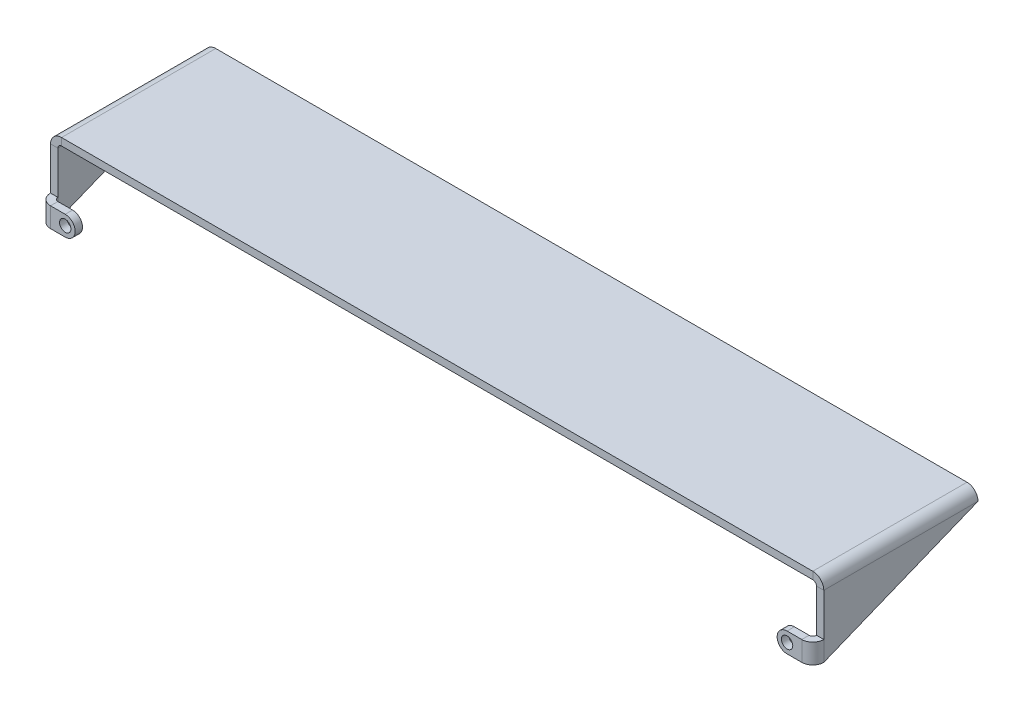
from build123d import *

# Parameters (mm, degrees)
SKETCH1_W                          = 210.6
SKETCH1_H                          = 45
BASE_FLANGE1_DEPTH                 = 2
SM_EDGE_FLANGE_1_STRIP_W           = 10
SM_EDGE_FLANGE_1_STRIP_H           = 2
SM_EDGE_FLANGE_1_STRIP_CUT_DEPTH   = 45
SM_EDGE_FLANGE_1_STRIP_2_W         = 10
SM_EDGE_FLANGE_1_STRIP_2_H         = 2
SM_EDGE_FLANGE_1_STRIP_CUT_2_DEPTH = 45
SM_EDGE_FLANGE_1_DEPTH             = 45
SM_EDGE_FLANGE_1_BEND_DEPTH        = 45
SM_START                           = -20
SM_EDGE_FLANGE_2_DEPTH             = 20
SM_START_2                         = -3
SM_EDGE_FLANGE_2_2_DEPTH           = 3
SM_EDGE_FLANGE_2_3_DEPTH           = 17
SKETCH18_R                         = 1.55
CUT_EXTRUDE4_DEPTH                 = 10
CUT_EXTRUDE5_DEPTH                 = 213.740710726
CUT_EXTRUDE5_DEPTH_BACK            = 213.740710726
SKETCH22_W                         = 3
SKETCH22_H                         = 2
SKETCH22_H_2                       = 11.6


# Read off the part's stored shape, not the designer's step: Ребро-кромка2
# Sheet-metal steps are written as plain solids
with BuildPart() as part:
    # Sketch1 → Base-Flange1 (new body)
    with BuildSketch(Plane(origin=(0, 0, 0), x_dir=(1, 0, 0), z_dir=(0, 1, 0))):
        Rectangle(SKETCH1_W, SKETCH1_H)
    extrude(amount=-BASE_FLANGE1_DEPTH)

    # Ребро-кромка1 strip (across the edge) → Ребро-кромка1 strip cut (cut)
    with BuildSketch(Plane(origin=(-105.3, -2, 22.5), x_dir=(1, 0, 0), z_dir=(0, 0, -1))):
        with Locations((-2, -1)):
            Rectangle(SM_EDGE_FLANGE_1_STRIP_W, SM_EDGE_FLANGE_1_STRIP_H)
    extrude(amount=SM_EDGE_FLANGE_1_STRIP_CUT_DEPTH, mode=Mode.SUBTRACT)

    # Ребро-кромка1 strip 2 (across the edge) → Ребро-кромка1 strip cut 2 (cut)
    with BuildSketch(Plane(origin=(105.3, -2, -22.5), x_dir=(-1, 0, 0), z_dir=(0, 0, 1))):
        with Locations((-2, -1)):
            Rectangle(SM_EDGE_FLANGE_1_STRIP_2_W, SM_EDGE_FLANGE_1_STRIP_2_H)
    extrude(amount=SM_EDGE_FLANGE_1_STRIP_CUT_2_DEPTH, mode=Mode.SUBTRACT)

    # Ребро-кромка1 section (across the edge) → Ребро-кромка1 (add)
    with BuildSketch(Plane(origin=(-105.3, -2, 22.5), x_dir=(1, 0, 0), z_dir=(0, 0, -1))):
        with BuildLine():
            Line((0, 1), (0, 18))
            Line((0, 18), (2, 18))
            Line((2, 18), (2, 1))
            ThreePointArc((2, 1), (2.292893219, 0.292893219), (3, 0))
            Line((3, 0), (3, -2))
            ThreePointArc((3, -2), (0.878679656, -1.121320344), (0, 1))
        make_face()
    extrude(amount=SM_EDGE_FLANGE_1_DEPTH)

    # Ребро-кромка1 section 2 (across the edge) → Ребро-кромка1 bend (add)
    with BuildSketch(Plane(origin=(105.3, -2, -22.5), x_dir=(-1, 0, 0), z_dir=(0, 0, 1))):
        with BuildLine():
            Line((0, 1), (0, 18))
            Line((0, 18), (2, 18))
            Line((2, 18), (2, 1))
            ThreePointArc((2, 1), (2.292893219, 0.292893219), (3, 0))
            Line((3, 0), (3, -2))
            ThreePointArc((3, -2), (0.878679656, -1.121320344), (0, 1))
        make_face()
    extrude(amount=SM_EDGE_FLANGE_1_BEND_DEPTH)

    # Ребро-кромка2 outline → Ребро-кромка2 (cut)
    with BuildSketch(Plane(origin=(0, 0, 0), x_dir=(1, 0, 0), z_dir=(0, 1, 0)).offset(SM_START)):
        with BuildLine():
            Line((-102.3, -20.5), (-102.3, -19.5))
            Line((-102.3, -19.5), (-103.3, -19.5))
            ThreePointArc((-103.3, -19.5), (-103.007106781, -20.207106781), (-102.3, -20.5))
        make_face()
        with BuildLine():
            ThreePointArc((-102.3, -22.5), (-104.421320344, -21.621320344), (-105.3, -19.5))
            Line((-105.3, -19.5), (-105.3, -22.5))
            Line((-105.3, -22.5), (-102.3, -22.5))
        make_face()
        with BuildLine():
            Line((102.3, -22.5), (105.3, -22.5))
            Line((105.3, -22.5), (105.3, -19.5))
            ThreePointArc((105.3, -19.5), (104.421320344, -21.621320344), (102.3, -22.5))
        make_face()
        with BuildLine():
            Line((102.3, -19.5), (102.3, -20.5))
            ThreePointArc((102.3, -20.5), (103.007106781, -20.207106781), (103.3, -19.5))
            Line((103.3, -19.5), (102.3, -19.5))
        make_face()
    extrude(amount=SM_EDGE_FLANGE_2_DEPTH, mode=Mode.SUBTRACT)

    # Sm Edge Flange 2 2 outline → Sm Edge Flange 2 2 (cut)
    with BuildSketch(Plane(origin=(0, 0, 0), x_dir=(1, 0, 0), z_dir=(0, 1, 0)).offset(SM_START_2)):
        with BuildLine():
            Line((-102.3, -22.5), (-102.3, -20.5))
            ThreePointArc((-102.3, -20.5), (-103.007106781, -20.207106781), (-103.3, -19.5))
            Line((-103.3, -19.5), (-105.3, -19.5))
            ThreePointArc((-105.3, -19.5), (-104.421320344, -21.621320344), (-102.3, -22.5))
        make_face()
        with BuildLine():
            Line((102.3, -20.5), (102.3, -22.5))
            ThreePointArc((102.3, -22.5), (104.421320344, -21.621320344), (105.3, -19.5))
            Line((105.3, -19.5), (103.3, -19.5))
            ThreePointArc((103.3, -19.5), (103.007106781, -20.207106781), (102.3, -20.5))
        make_face()
    extrude(amount=SM_EDGE_FLANGE_2_2_DEPTH, mode=Mode.SUBTRACT)

    # Sm Edge Flange 2 3 outline → Sm Edge Flange 2 3 (add)
    with BuildSketch(Plane(origin=(0, 0, 0), x_dir=(1, 0, 0), z_dir=(0, 1, 0)).offset(SM_START)):
        with BuildLine():
            Line((93.3, -20.5), (93.3, -22.5))
            Line((93.3, -22.5), (102.3, -22.5))
            ThreePointArc((102.3, -22.5), (102.807305936, -22.456795679), (103.3, -22.328427125))
            Line((103.3, -22.328427125), (103.3, -19.5))
            ThreePointArc((103.3, -19.5), (103.007106781, -20.207106781), (102.3, -20.5))
            Line((102.3, -20.5), (93.3, -20.5))
        make_face()
        with BuildLine():
            Line((-93.3, -20.5), (-102.3, -20.5))
            ThreePointArc((-102.3, -20.5), (-103.007106781, -20.207106781), (-103.3, -19.5))
            Line((-103.3, -19.5), (-103.3, -22.328427125))
            ThreePointArc((-103.3, -22.328427125), (-102.807305936, -22.456795679), (-102.3, -22.5))
            Line((-102.3, -22.5), (-93.3, -22.5))
            Line((-93.3, -22.5), (-93.3, -20.5))
        make_face()
    extrude(amount=SM_EDGE_FLANGE_2_3_DEPTH)

    # Sketch18 → Cut-Extrude4 (cut)
    with BuildSketch(Plane(origin=(0, 0, 20.5), x_dir=(-1, 0, 0), z_dir=(0, 0, -1))):
        with Locations((-98.3, -17.3)):
            Circle(SKETCH18_R)
        with Locations((98.3, -17.3)):
            Circle(SKETCH18_R)
        with BuildLine():
            Line((-93.3, -2), (-102.3, -2))
            Line((-102.3, -2), (-102.3, -14.6))
            Line((-102.3, -14.6), (-98.3, -14.6))
            ThreePointArc((-98.3, -14.6), (-95.6, -17.3), (-98.3, -20))
            Line((-98.3, -20), (-93.3, -20))
            Line((-93.3, -20), (-93.3, -14.6))
            Line((-93.3, -14.6), (-93.3, -2))
        make_face()
        with BuildLine():
            Line((93.3, -14.6), (93.3, -20))
            Line((93.3, -20), (98.3, -20))
            ThreePointArc((98.3, -20), (95.6, -17.3), (98.3, -14.6))
            Line((98.3, -14.6), (102.3, -14.6))
            Line((102.3, -14.6), (102.3, -2))
            Line((102.3, -2), (93.3, -2))
            Line((93.3, -2), (93.3, -14.6))
        make_face()
    extrude(amount=-CUT_EXTRUDE4_DEPTH, mode=Mode.SUBTRACT)

    # Sketch22 → Cut-Extrude5 (cut, two sides: drawn at the far end of the back side and taken through both)
    with BuildSketch(Plane.ZY.offset(105.3).offset(-CUT_EXTRUDE5_DEPTH_BACK)):
        with Locations((21, -1)):
            Rectangle(SKETCH22_W, SKETCH22_H)
        Polygon((-22.5, -3), (19.5, -20), (-22.5, -20), align=None)
        with Locations((21, -8.8)):
            Rectangle(SKETCH22_W, SKETCH22_H_2)
    extrude(amount=CUT_EXTRUDE5_DEPTH + CUT_EXTRUDE5_DEPTH_BACK, mode=Mode.SUBTRACT)


solid = part.part
